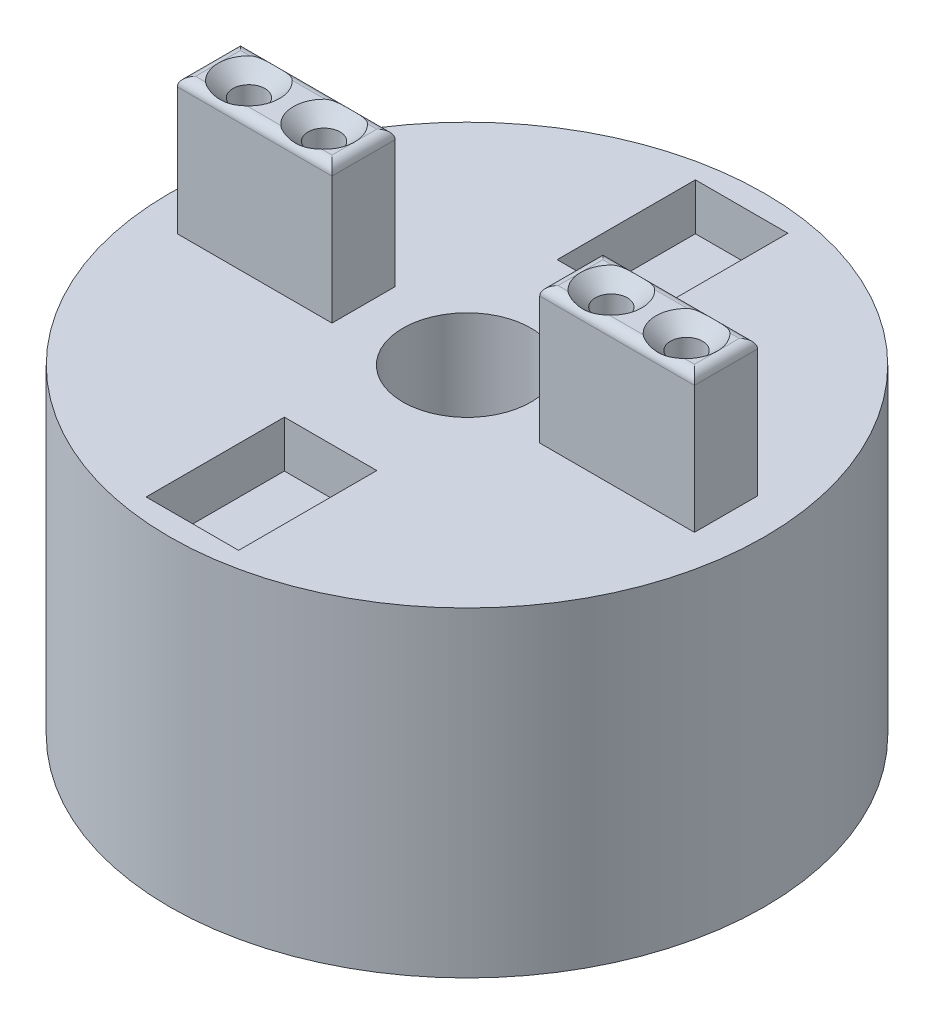
from build123d import *

# Parameters (mm, degrees)
SKETCH1_R           = 32.5
BOSS_EXTRUDE1_DEPTH = 35
SKETCH2_W           = 10.1
SKETCH2_H           = 15.1
CUT_EXTRUDE1_DEPTH  = 5.1
SKETCH3_R           = 7
CUT_EXTRUDE2_DEPTH  = 58.771100041
SKETCH4_W           = 16.9
SKETCH4_H           = 6.9
BOSS_EXTRUDE2_DEPTH = 14.9
FILLET2_R           = 1
SKETCH5_R           = 1.75
CUT_EXTRUDE3_DEPTH  = 30
CHAMFER1_SIZE       = 1.6


with BuildPart() as part:
    # Sketch1 → Boss-Extrude1 (new body)
    with BuildSketch(Plane(origin=(0, 0, 0), x_dir=(1, 0, 0), z_dir=(0, 1, 0))):
        with Locations(Location((0, 0, 0), (0, 0, 270))):
            Circle(SKETCH1_R)
    extrude(amount=BOSS_EXTRUDE1_DEPTH)

    # Sketch2 → Cut-Extrude1 (cut)
    with BuildSketch(Plane(origin=(0, 35, 0), x_dir=(1, 0, 0), z_dir=(0, 1, 0))):
        with Locations((0, 22.45)):
            Rectangle(SKETCH2_W, SKETCH2_H)
        with Locations((0, -22.45)):
            Rectangle(SKETCH2_W, SKETCH2_H)
    extrude(amount=-CUT_EXTRUDE1_DEPTH, mode=Mode.SUBTRACT)

    # Sketch3 → Cut-Extrude2 (cut, through all)
    with BuildSketch(Plane(origin=(0, 35, 0), x_dir=(1, 0, 0), z_dir=(0, 1, 0))):
        with Locations(Location((0, 0, 0), (0, 0, 270))):
            Circle(SKETCH3_R)
    extrude(amount=-CUT_EXTRUDE2_DEPTH, mode=Mode.SUBTRACT)

    # Sketch4 → Boss-Extrude2 (add)
    with BuildSketch(Plane(origin=(0, 35, 0), x_dir=(1, 0, 0), z_dir=(0, 1, 0))):
        with Locations((19.796175473, 0.05)):
            Rectangle(SKETCH4_W, SKETCH4_H)
        with Locations((-19.796175473, 0.05)):
            Rectangle(SKETCH4_W, SKETCH4_H)
    extrude(amount=BOSS_EXTRUDE2_DEPTH)

    # Fillet2
    fillet2_edges = [part.edges().sort_by_distance(p)[0] for p in [
        (28.246175473, 49.9, -0.05),
        (19.796175473, 49.9, -3.5),
        (11.346175473, 49.9, -0.05),
        (19.796175473, 49.9, 3.4),
        (-19.796175473, 49.9, 3.4),
        (-11.346175473, 49.9, -0.05),
        (-19.796175473, 49.9, -3.5),
        (-28.246175473, 49.9, -0.05),
    ]]
    fillet(fillet2_edges, radius=FILLET2_R)

    # Sketch5 → Cut-Extrude3 (cut)
    with BuildSketch(Plane(origin=(0, 49.9, 0), x_dir=(1, 0, 0), z_dir=(0, 1, 0))):
        with Locations(Location((23.901775473, 0.078488913, 0), (0, 0, 270))):
            Circle(SKETCH5_R)
        with Locations(Location((15.690575474, 0.078488913, 0), (0, 0, 90))):
            Circle(SKETCH5_R)
        with Locations(Location((-15.690575474, 0.078488913, 0), (0, 0, 270))):
            Circle(SKETCH5_R)
        with Locations(Location((-23.901775473, 0.078488913, 0), (0, 0, 90))):
            Circle(SKETCH5_R)
    extrude(amount=-CUT_EXTRUDE3_DEPTH, mode=Mode.SUBTRACT)

    # Chamfer1
    # the kernel refuses this chamfer: 1.6 mm, written as the material it takes off along each edge
    with BuildSketch(Plane(origin=(23.901775473, 49.9, -0.078488913), x_dir=(0, 0, 1), z_dir=(-1, 0, 0))) as chamfer1_piece_1:
        Polygon((1.75 + CHAMFER1_SIZE, 0), (1.75, -CHAMFER1_SIZE), (1.75, 0), align=None)
    revolve(axis=Axis((23.901775473, 49.9, -0.078488913), (0, 1, 0)), mode=Mode.SUBTRACT)
    with BuildSketch(Plane(origin=(-15.690575474, 49.9, -0.078488913), x_dir=(0, 0, 1), z_dir=(-1, 0, 0))) as chamfer1_piece_2:
        Polygon((1.75 + CHAMFER1_SIZE, 0), (1.75, -CHAMFER1_SIZE), (1.75, 0), align=None)
    revolve(axis=Axis((-15.690575474, 49.9, -0.078488913), (0, 1, 0)), mode=Mode.SUBTRACT)
    with BuildSketch(Plane(origin=(15.690575474, 49.9, -0.078488913), x_dir=(0, 0, -1), z_dir=(1, 0, 0))) as chamfer1_piece_3:
        Polygon((1.75 + CHAMFER1_SIZE, 0), (1.75, -CHAMFER1_SIZE), (1.75, 0), align=None)
    revolve(axis=Axis((15.690575474, 49.9, -0.078488913), (0, 1, 0)), mode=Mode.SUBTRACT)
    with BuildSketch(Plane(origin=(-23.901775473, 49.9, -0.078488913), x_dir=(0, 0, -1), z_dir=(1, 0, 0))) as chamfer1_piece_4:
        Polygon((1.75 + CHAMFER1_SIZE, 0), (1.75, -CHAMFER1_SIZE), (1.75, 0), align=None)
    revolve(axis=Axis((-23.901775473, 49.9, -0.078488913), (0, 1, 0)), mode=Mode.SUBTRACT)


solid = part.part
